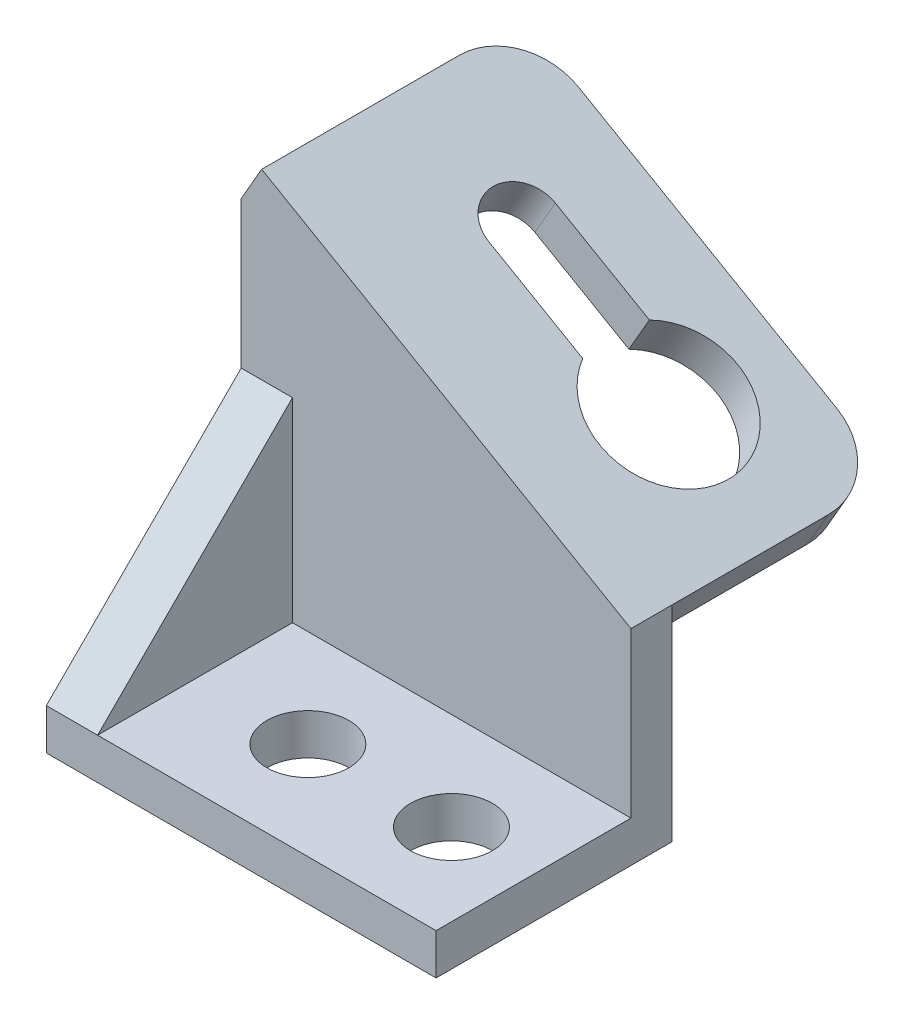
from build123d import *

# Parameters (mm, degrees)
BASE_EXTRUDE_THIN_DEPTH = 76
BOSS_EXTRUDE1_START     = -8
BOSS_EXTRUDE1_DEPTH     = 8
SKETCH3_W               = 87.757240917
SKETCH3_H               = 51
BOSS_EXTRUDE2_DEPTH     = 8
CUT_EXTRUDE1_DEPTH      = 119.888876867
FILLET1_R               = 12.5
BOSS_EXTRUDE3_DEPTH     = 10
CUT_EXTRUDE2_DEPTH      = 101.073742043
SKETCH9_R               = 8
CUT_EXTRUDE3_DEPTH      = 118.428403891
LPATTERN2_COUNT         = 2
LPATTERN2_PITCH         = 28


# Read off the part's stored shape, not the designer's step: Boss-Extrude1
with BuildPart() as part:
    # Sketch1 → Base-Extrude-Thin (new body)
    with BuildSketch(Plane(origin=(0, 0, 0), x_dir=(0, 0, -1), z_dir=(1, 0, 0))):
        Polygon((-38, 0), (0, 0), (0, 32), (8, 32), (8, -8), (-38, -8), align=None)
    extrude(amount=BASE_EXTRUDE_THIN_DEPTH)

    # Boss-Extrude1 outline → Boss-Extrude1 (add)
    with BuildSketch(Plane.XY.offset(BOSS_EXTRUDE1_START)):
        Polygon((76, 32), (0, 75.878620458), (0, 32), align=None)
    extrude(amount=BOSS_EXTRUDE1_DEPTH)

    # Sketch3 → Boss-Extrude2 (add)
    with BuildSketch(Plane(origin=(32.856406461, 56.908965344, 0), x_dir=(-0.8660254037844379, 0.5000000000000014, 0), z_dir=(0.5000000000000014, 0.8660254037844379, 0))):
        with Locations((-5.93931023, -25.5)):
            Rectangle(SKETCH3_W, SKETCH3_H)
    extrude(amount=-BOSS_EXTRUDE2_DEPTH)

    # Sketch4 → Cut-Extrude1 (cut, through all)
    with BuildSketch(Plane.XY):
        Polygon((-113.800448301, -130.46714223), (0, 66.641016151), (4, 73.569219382), (117.800448301, 270.677377763), (-276.415868462, 498.278274366), (-508.016765065, 97.133754372), align=None)
    extrude(amount=-CUT_EXTRUDE1_DEPTH, mode=Mode.SUBTRACT)

    # Fillet1
    fillet1_edges = [part.edges().sort_by_distance(p)[0] for p in [
        (74, 28.535898385, -51),
        (2, 70.105117767, -51),
    ]]
    fillet(fillet1_edges, radius=FILLET1_R)

    # Sketch5 → Boss-Extrude3 (add)
    with BuildSketch(Plane.ZY):
        Polygon((0, 38), (0, 0), (38, 0), align=None)
    extrude(amount=-BOSS_EXTRUDE3_DEPTH)

    # Sketch6 → Cut-Extrude2 (cut, through all)
    with BuildSketch(Plane(origin=(24.713169413, 61.610465445, -0.61351416), x_dir=(-0.866025403784438, 0.5000000000000012, 0), z_dir=(0.5000000000000011, 0.8660254037844379, 0))):
        with BuildLine():
            Line((-1.220930891, -34.88648584), (-22.388771324, -34.88648584))
            ThreePointArc((-22.388771324, -34.88648584), (-47.720930891, -28.38648584), (-22.388771324, -21.88648584))
            Line((-22.388771324, -21.88648584), (-1.220930891, -21.88648584))
            ThreePointArc((-1.220930891, -21.88648584), (5.279069109, -28.38648584), (-1.220930891, -34.88648584))
        make_face()
    extrude(amount=-CUT_EXTRUDE2_DEPTH, mode=Mode.SUBTRACT)

    # Sketch9 → Cut-Extrude3 (cut, through all)
    with BuildSketch(Plane(origin=(0, 0, 0), x_dir=(-1, 0, 0), z_dir=(0, 1, 0))):
        with Locations(Location((-60, 19, 0), (0, 0, 90))):
            Circle(SKETCH9_R)
    cut_extrude3 = extrude(amount=-CUT_EXTRUDE3_DEPTH, mode=Mode.SUBTRACT)

    # LPattern2: Cut-Extrude3 ×2
    with Locations(*[(-i * LPATTERN2_PITCH, 0, 0) for i in range(1, LPATTERN2_COUNT)]):
        add(cut_extrude3, mode=Mode.SUBTRACT)


solid = part.part
